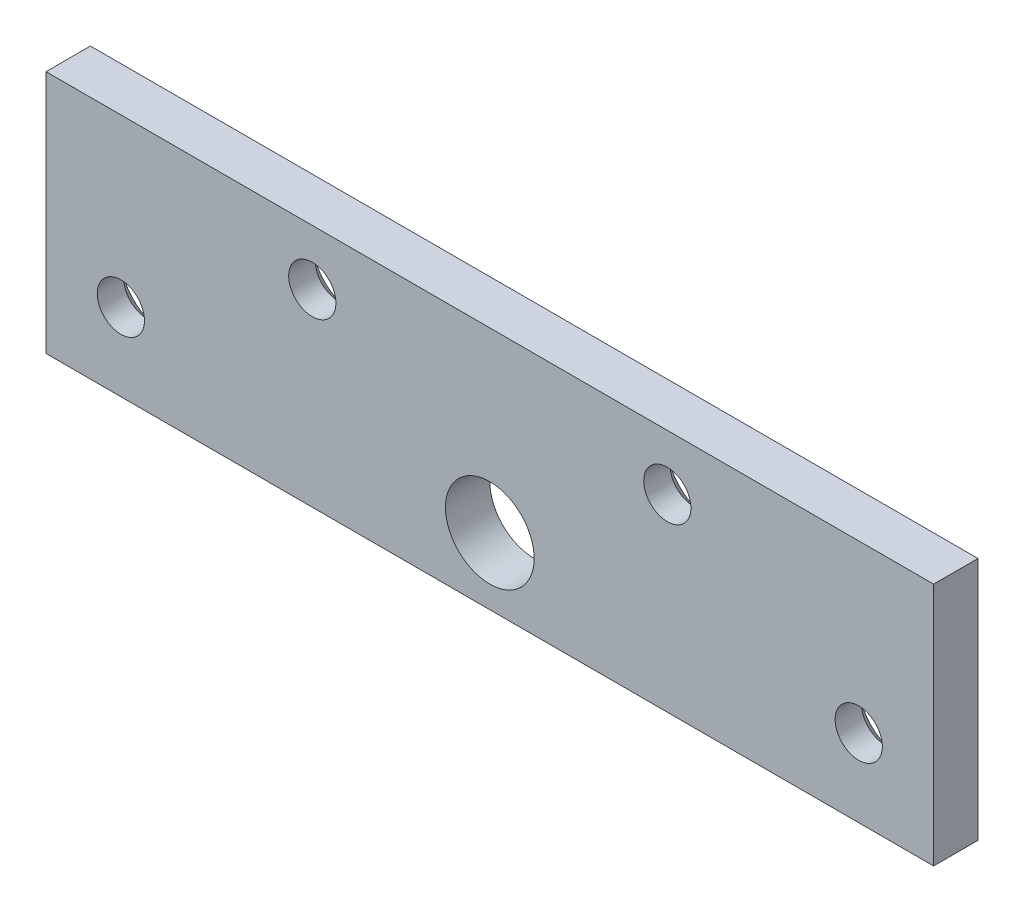
from build123d import *

# Parameters (mm, degrees)
SKETCH1_W                                           = 127
SKETCH1_H                                           = 34.925
SKETCH1_R                                           = 6.35
BOSS_EXTRUDE1_DEPTH                                 = 6.35
CSK_FOR_1_4_FLAT_HEAD_MACHINE_SCREW_100_D           = 6.7564
CSK_FOR_1_4_FLAT_HEAD_MACHINE_SCREW_100_CSINK_D     = 12.8778
CSK_FOR_1_4_FLAT_HEAD_MACHINE_SCREW_100_CSINK_ANGLE = 100


with BuildPart() as part:
    # Sketch1 → Boss-Extrude1 (new body)
    with BuildSketch(Plane.XY):
        with Locations((63.5, 14.2875)):
            Rectangle(SKETCH1_W, SKETCH1_H)
        with Locations((63.5, 6.35)):
            Circle(SKETCH1_R, mode=Mode.SUBTRACT)
    extrude(amount=BOSS_EXTRUDE1_DEPTH)

    # CSK for 1/4 Flat Head Machine Screw (100)2 (through all)
    with Locations(Plane(origin=(248.332419753, -44.45, 0), x_dir=(-1, 0, 0), z_dir=(0, 0, -1))):
        with Locations((210.232419753, 68.2625), (159.432419753, 68.2625), (132.048868421, 52.3875), (237.615971086, 52.3875)):
            CounterSinkHole(CSK_FOR_1_4_FLAT_HEAD_MACHINE_SCREW_100_D / 2, CSK_FOR_1_4_FLAT_HEAD_MACHINE_SCREW_100_CSINK_D / 2, counter_sink_angle=CSK_FOR_1_4_FLAT_HEAD_MACHINE_SCREW_100_CSINK_ANGLE)


solid = part.part
